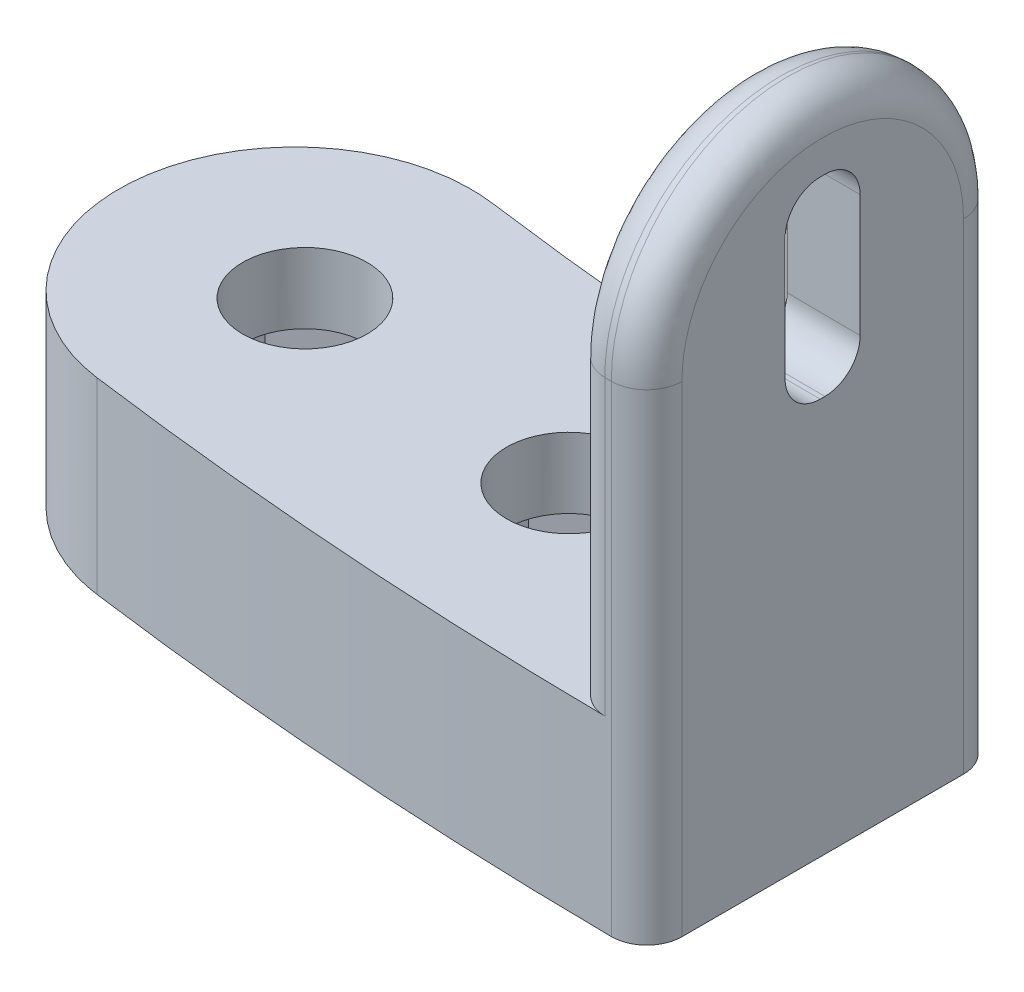
from build123d import *

# Parameters (mm, degrees)
EXTRUDE_1_DEPTH     = 8
EXTRUDE_2_DEPTH     = 20
HOLE_WIZARD_M5_1_D  = 5.3
FILLET_1_R          = 7.5
FILLET_2_DEPTH      = 8
SKETCH_5_W          = 3.1999999999999886
SKETCH_5_H          = 8.2
FILLET_3_R          = 1.5
FILLET_4_R          = 1.5
CUT_EXTRUDE_1_DEPTH = 5


with BuildPart() as part:
    # 草图1 → 凸台-拉伸1 (new body)
    with BuildSketch(Plane(origin=(0, 0, 0), x_dir=(1, 0, 0), z_dir=(0, 1, 0))):
        with BuildLine():
            Line((2.098e-14, -189), (1.932e-14, -174.00000000000003))
            ThreePointArc((2.28618e-12, -174.00000000000003), (-15.165099238093463, -173.33787746796366), (-30.214782914050144, -171.35654902412347))
            Line((-30.214782914045937, -171.35654902412418), (-32.8195055790499, -186.12866531930732))
            ThreePointArc((-32.81950557905, -186.12866531930732), (-16.472435379307413, -188.28079793933995), (-3.472e-14, -189.00000000000003))
        make_face()
    extrude(amount=EXTRUDE_1_DEPTH)

    # 草图4 → 凸台-拉伸2 (add)
    with BuildSketch(Plane(origin=(0, 8, 0), x_dir=(1, 0, 0), z_dir=(0, 1, 0))):
        with BuildLine():
            Line((2.082e-14, -189), (1.916e-14, -174))
            ThreePointArc((-3.196e-14, -174.00000000000003), (-1.5184171767173116, -173.99337461316583), (-3.0367187200877925, -173.9734989572121))
            Line((-3.036718720087315, -173.97349895721206), (-3.298504816646567, -188.97121438455795))
            ThreePointArc((-3.2985048166465822, -188.971214384558), (-1.6493152091926062, -188.99280345912842), (-3.472e-14, -189.00000000000006))
        make_face()
    extrude(amount=EXTRUDE_2_DEPTH)

    # M5 间隙孔1 (through all)
    with Locations(Plane(origin=(0, 8, 0), x_dir=(1, 0, 0), z_dir=(0, 1, 0))):
        with Locations((-23.608051681, -179.958078162), (-11.163314825, -181.156370029)):
            Hole(HOLE_WIZARD_M5_1_D / 2)

    # 圆角1
    # the kernel refuses this fillet: 7.5 mm, written as the material it takes off along each edge
    with BuildSketch(Plane(origin=(1.47232e-12, 28, -1.0760459e-10), x_dir=(0.10755019962978496, 0, 0.9941996552803635), z_dir=(0.9941996552803635, 0, -0.10755019962978496))) as fillet_1_piece_1:
        with BuildLine():
            CenterArc((174.00000000010766 + FILLET_1_R, FILLET_1_R), FILLET_1_R, 180, 89.99999999999977)
            Line((174.00000000010766 + FILLET_1_R, 0), (174.00000000010766, 0))
            Line((174.00000000010766, 0), (174.00000000010766, FILLET_1_R))
        make_face()
    revolve(axis=Axis((1.47232e-12, 28, -1.0760459e-10), (0, -1, 0)), revolution_arc=13.348228955549553, mode=Mode.SUBTRACT)
    with BuildSketch(Plane(origin=(2.05469e-12, 28, -2.9481839e-10), x_dir=(-0.11639521392683701, 0, 0.9932029773288671), z_dir=(-0.9932029773288671, 0, -0.11639521392683701))) as fillet_1_piece_2:
        with BuildLine():
            CenterArc((189.0000000002949 - FILLET_1_R, -FILLET_1_R), FILLET_1_R, 0, 89.99999999999957)
            Line((189.0000000002949 - FILLET_1_R, 0), (189.0000000002949, 0))
            Line((189.0000000002949, 0), (189.00000000029488, -FILLET_1_R))
        make_face()
    revolve(axis=Axis((2.05469e-12, 28, -2.9481839e-10), (0, 1, 0)), revolution_arc=12.368210784462358, mode=Mode.SUBTRACT)

    # 圆角2: read off the stored shape, not the designer's step
    # 圆角2 outline → 圆角2 (cut)
    with BuildSketch(Plane(origin=(0, 0, 0), x_dir=(1, 0, 0), z_dir=(0, 1, 0))):
        with BuildLine():
            ThreePointArc((-32.819505579, -186.128665319), (-28.966041771, -186.767150281), (-25.100206236, -187.325864863))
            add(Edge.make_bspline(
                [(-25.100206236, -187.325864863), (-27.006863278382305, -187.07038767754574), (-29.132080374521447, -186.17341393049847), (-31.048536919413714, -184.35464406978926), (-32.02623112721157, -181.62978297542463), (-31.490224503, -178.589937725)],
                knots=[0, 0, 0, 0, 0, 0, 0.5103349834155644, 0.5103349834155644, 0.5103349834155644, 0.5103349834155644, 0.5103349834155644, 0.5103349834155644], degree=5, weights=[1, 0.7958660065557144, 0.6438203721908997, 0.5438630969055563, 0.4959941806996843, 0.5002136235732837]))
            Line((-31.490224503, -178.589937725), (-32.819505579, -186.128665319))
        make_face()
        with BuildLine():
            Line((-30.214782914, -171.356549024), (-31.490224503, -178.589937725))
            add(Edge.make_bspline(
                [(-31.490224503, -178.589937725), (-30.984360135627078, -175.72103774319677), (-29.29551148466263, -173.58668082656104), (-27.075163325391554, -172.48015181385665), (-24.918748626576246, -172.21612345785414), (-23.108126376, -172.458732732)],
                knots=[0.5103349834155644, 0.5103349834155644, 0.5103349834155644, 0.5103349834155644, 0.5103349834155644, 0.5103349834155644, 1, 1, 1, 1, 1, 1], degree=5, weights=[0.5002136235732837, 0.5042621674352976, 0.5562650770089762, 0.6562223522943196, 0.8041339932913276, 1]))
            ThreePointArc((-23.108126376, -172.458732732), (-26.667149567, -171.944360576), (-30.214782914, -171.356549024))
        make_face()
    extrude(amount=FILLET_2_DEPTH, mode=Mode.SUBTRACT)

    # 草图5 → 切除-旋转1 (revolve, cut)
    with BuildSketch(Plane(origin=(0, 0, 0), x_dir=(-0.01745240643728342, 0, 0.9998476951563913), z_dir=(-0.9998476951563913, 0, -0.01745240643728342))):
        with Locations((181.5, 20.99999999999998)):
            Rectangle(SKETCH_5_W, SKETCH_5_H)
    revolve(axis=Axis((0, 55.00000000000001, 0), (0, -1, 0)), mode=Mode.SUBTRACT)

    # 圆角3
    fillet_3_edges = [part.edges().sort_by_distance(p)[0] for p in [
        (-1.5978286497523058, 25.09999999999998, 183.09302811304977),
        (-1.5978286497523058, 16.899999999999984, 183.09302811304977),
        (-1.5699037361575081, 16.899999999999984, 179.89314995924443),
        (-1.5699037361575081, 25.09999999999998, 179.89314995924443),
    ]]
    fillet(fillet_3_edges, radius=FILLET_3_R)

    # 圆角4
    fillet_4_edges = [part.edges().sort_by_distance(p)[0] for p in [
        (-8.49e-15, 10.25, 189.00000000000003),
        (-3.2985048166465747, 14.25, 188.97121438455798),
        (-3.0367187200875536, 14.25, 173.9734989572121),
        (7.2842e-13, 10.25, 174.00000000000003),
        (-1.5838661929530051, 28, 181.4930890361471),
        (-1.5838661929530051, 28, 181.4930890361471),
    ]]
    fillet(fillet_4_edges, radius=FILLET_4_R)

    # 草图6 → 切除-拉伸1 (cut)
    with BuildSketch(Plane.XZ):
        Polygon((-23.608051681342282, 175.2815409817045), (-19.55805168134228, 177.6198095719225), (-19.55805168134228, 182.29634675235855), (-23.608051681342257, 184.6346153425765), (-27.658051681342297, 182.29634675235852), (-27.658051681342297, 177.6198095719225), align=None)
        Polygon((-11.163314825368898, 176.479832848635), (-7.113314825368922, 178.81810143885298), (-7.1133148253689225, 183.49463861928896), (-11.163314825368879, 185.83290720950694), (-15.213314825368883, 183.49463861928893), (-15.213314825368883, 178.81810143885298), align=None)
    extrude(amount=-CUT_EXTRUDE_1_DEPTH, mode=Mode.SUBTRACT)


solid = part.part
